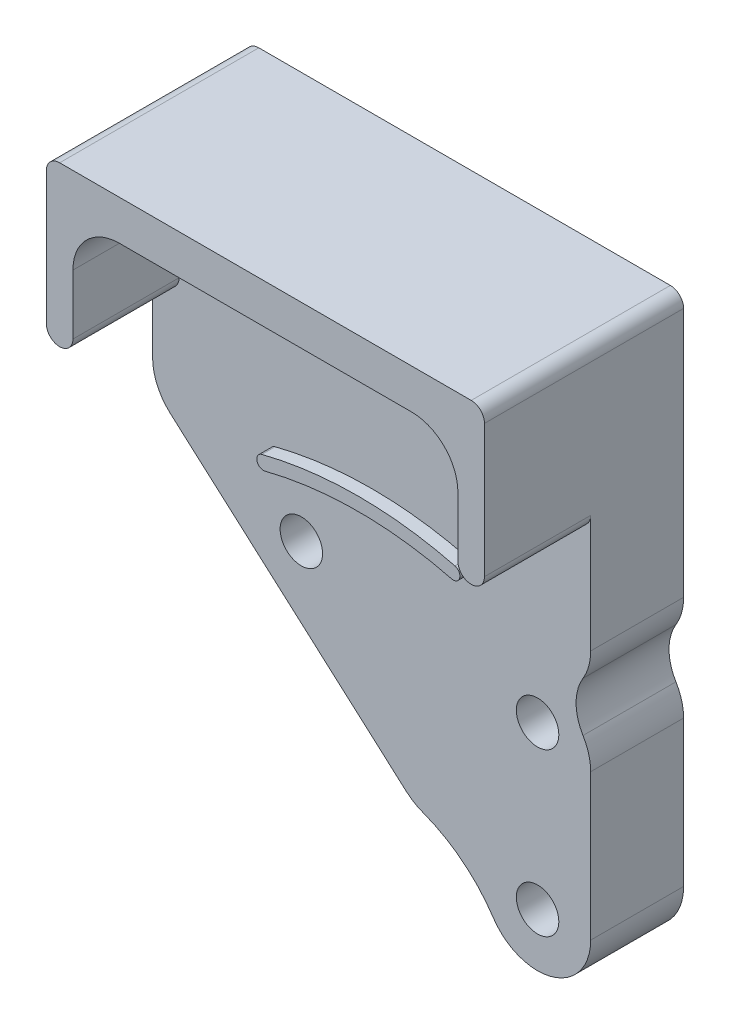
from build123d import *

# Parameters (mm, degrees)
BOSS_EXTRUDE1_DEPTH = 7
BOSS_EXTRUDE2_DEPTH = 8
FILLET1_R           = 3.5
BOSS_EXTRUDE3_DEPTH = 1
FILLET5_R           = 0.5
SKETCH3_R           = 3.6
SKETCH3_R_2         = 3.55
CUT_EXTRUDE2_DEPTH  = 12
FILLET7_R           = 4
FILLET8_R           = 1
SKETCH5_R           = 1.65
SKETCH5_R_2         = 1.6
CUT_EXTRUDE3_DEPTH  = 51.450470761
FILLET12_R          = 4


# Some blends are built 0.0001 mm under size
with BuildPart() as part:
    # Sketch1 → Boss-Extrude1 (new body)
    with BuildSketch(Plane.XY):
        with BuildLine():
            Line((16.5, 47), (-16.5, 47))
            Line((-16.5, 47), (-16.5, 28))
            Line((-16.5, 28), (3.206829084, 10.522178825))
            ThreePointArc((3.206829084, 10.522178825), (7.298815617, 8.229659203), (10.063744764, 4.440837907))
            Line((10.063744764, 4.440837907), (16.5, -1.267422796))
            Line((16.5, -1.267422796), (16.5, 47))
        make_face()
    extrude(amount=BOSS_EXTRUDE1_DEPTH)

    # Sketch2 → Boss-Extrude2 (add)
    with BuildSketch(Plane.XY.offset(7)):
        Polygon((-16.5, 35), (-16.5, 47), (16.5, 47), (16.5, 35), (14.5, 35), (14.5, 44), (-14.5, 44), (-14.5, 35), align=None)
    extrude(amount=BOSS_EXTRUDE2_DEPTH)

    # Fillet1
    fillet1_edges = [part.edges().sort_by_distance(p)[0] for p in [
        (-14.5, 44, 11),
        (14.5, 44, 11),
    ]]
    fillet(fillet1_edges, radius=FILLET1_R)

    # Sketch4 → Boss-Extrude3 (add)
    with BuildSketch(Plane.XY.offset(7)):
        with BuildLine():
            ThreePointArc((7.763157895, 28.460206948), (0, 29.5), (-7.763157895, 28.460206948))
            Line((-7.763157895, 28.460206948), (-7.5, 27.49545417))
            ThreePointArc((-7.5, 27.49545417), (0, 28.5), (7.5, 27.49545417))
            Line((7.5, 27.49545417), (7.763157895, 28.460206948))
        make_face()
    extrude(amount=BOSS_EXTRUDE3_DEPTH)

    # Fillet5
    fillet5_edges = [part.edges().sort_by_distance(p)[0] for p in [
        (7.763157895, 28.460206948, 7.5),
        (7.5, 27.49545417, 7.5),
        (-7.763157895, 28.460206948, 7.5),
        (-7.5, 27.49545417, 7.5),
    ]]
    fillet(fillet5_edges, radius=FILLET5_R - 0.0001)  # a hair under: the kernel refuses the full size

    # Sketch3 → Cut-Extrude2 (cut)
    with BuildSketch(Plane(origin=(0, 0, 0), x_dir=(-1, 0, 0), z_dir=(0, 0, -1))):
        with Locations((-19, 23.216373532)):
            Circle(SKETCH3_R)
        with Locations((19, 23.216373532)):
            Circle(SKETCH3_R_2)
    extrude(amount=-CUT_EXTRUDE2_DEPTH, mode=Mode.SUBTRACT)

    # Fillet7
    # the kernel refuses this fillet: 4 mm, written as the material it takes off along each edge
    with BuildSketch(Plane(origin=(3.206829084, 10.522178825, -2.00647278), x_dir=(0.9469871930704206, -0.3212713123834835, 0), z_dir=(0, 0, 1))) as fillet7_piece_1:
        with BuildLine():
            CenterArc((0.812259209, 3.998047556), FILLET7_R, 247.170276445, 21.039469781)
            Line((-0.739715882, 0.311399578), (0, 0))
            ThreePointArc((0, 0), (0.343648127, 0.005369221), (0.687296254, 0))
        make_face()
    extrude(amount=11.012945561, mode=Mode.SUBTRACT)
    with BuildSketch(Plane(origin=(-16.5, 28, -4.497372603), x_dir=(0.7481508366108257, -0.6635286924304943, 0), z_dir=(0, 0, 1))) as fillet7_piece_2:
        with BuildLine():
            CenterArc((FILLET7_R * 0.449737260328, FILLET7_R), FILLET7_R, 221.569549454, 48.430450546)
            Line((-FILLET7_R * 0.298413576283, FILLET7_R * 0.33647130757), (0, 0))
            Line((0, 0), (FILLET7_R * 0.449737260328, 0))
        make_face()
    extrude(amount=15.994745207, mode=Mode.SUBTRACT)
    with BuildSketch(Plane(origin=(16.5, -1.267422796, -22.201864002), x_dir=(0, 1, 0), z_dir=(0, 0, 1))) as fillet7_piece_3:
        with BuildLine():
            CenterArc((8.880745601, 4), FILLET7_R, 142.478159004, 127.521840996)
            Line((5.708260703, 6.436255236), (0, 0))
            Line((0, 0), (8.880745601, 0))
        make_face()
    extrude(amount=51.403728005, mode=Mode.SUBTRACT)
    with BuildSketch(Plane(origin=(16.5, 25.806740302, 10.36976741), x_dir=(0, 1, 0), z_dir=(0, 0, -1))) as fillet7_piece_4:
        with BuildLine():
            CenterArc((1.347906964, -4), FILLET7_R, 90, 31.211180498)
            ThreePointArc((-0.724868685, -0.578947368), (-0.343707491, -0.312920562), (0, 0))
            Line((0, 0), (1.347906964, 0))
        make_face()
    extrude(amount=13.739534821, mode=Mode.SUBTRACT)
    with BuildSketch(Plane(origin=(16.5, 20.626006763, 10.36976741), x_dir=(-0.6240720217299989, 0.7813668227496173, 0), z_dir=(0, 0, -1))) as fillet7_piece_5:
        with BuildLine():
            CenterArc((1.443078305, -3.966658315), FILLET7_R, 97.402928186, 31.211180498)
            Line((-1.053209782, -0.841191024), (0, 0))
            ThreePointArc((0, 0), (0.463846598, -0.030007516), (0.927693196, 0))
        make_face()
    extrude(amount=13.739534821, mode=Mode.SUBTRACT)

    # Fillet8
    fillet8_edges = [part.edges().sort_by_distance(p)[0] for p in [
        (-16.5, 47, 7.5),
        (16.5, 47, 7.5),
        (-16.5, 35, 11),
        (-14.5, 35, 11),
        (14.5, 35, 11),
        (16.5, 35, 11),
    ]]
    fillet(fillet8_edges, radius=FILLET8_R - 0.0001)  # a hair under: the kernel refuses the full size

    # Sketch5 → Cut-Extrude3 (cut, through all)
    with BuildSketch(Plane.XY.offset(7)):
        with Locations((-11, 40.5)):
            Circle(SKETCH5_R)
        with Locations((11, 40.5)):
            Circle(SKETCH5_R)
        with Locations((12.5, 8.291561976)):
            Circle(SKETCH5_R_2)
        with Locations((12.5, 20.487801249)):
            Circle(SKETCH5_R_2)
        with Locations((-5.294742993, 23.408667127)):
            Circle(SKETCH5_R_2)
    extrude(amount=-CUT_EXTRUDE3_DEPTH, mode=Mode.SUBTRACT)

    # Fillet12
    fillet12_edges = [part.edges().sort_by_distance(p)[0] for p in [
        (10.063744764, 4.440837907, 3.5),
    ]]
    fillet(fillet12_edges, radius=FILLET12_R - 0.0001)  # a hair under: the kernel refuses the full size


solid = part.part
